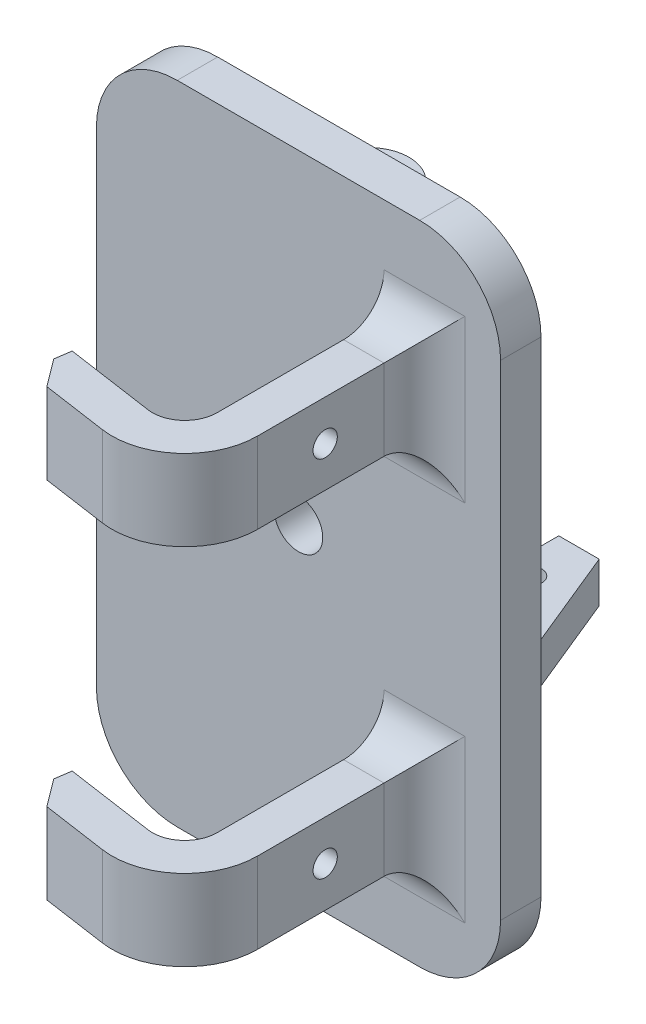
from build123d import *

# Parameters (mm, degrees)
ESQUISSE1_W             = 50
ESQUISSE1_H             = 80
BOSS_EXTRU_1_DEPTH      = 5
BOSS_EXTRU_2_START      = -42.4
ESQUISSE2_W             = 5
ESQUISSE2_H             = 12.2
ESQUISSE2_R             = 1.5
ESQUISSE2_W_2           = 5.01688185
BOSS_EXTRU_2_DEPTH      = 5
ESQUISSE3_R             = 3
ENL_V_MAT_EXTRU_1_DEPTH = 51.207967495
BOSS_EXTRU_3_START      = -10
ESQUISSE5_R             = 1.375
BOSS_EXTRU_3_DEPTH      = 5
ESQUISSE6_R             = 1.375
BOSS_EXTRU_4_DEPTH      = 10
BOSS_EXTRU_5_START      = -12.5
BOSS_EXTRU_5_DEPTH      = 10
CONG_1_R                = 5
CONG_2_R                = 5
CONG_3_R                = 5
CONG_1_OF_SYM_TRIE1_R   = 5
CONG_2_OF_SYM_TRIE1_R   = 5
CONG_3_OF_SYM_TRIE1_R   = 5
CHANFREIN1_SIZE         = 3
BOSS_EXTRU_6_DEPTH      = 5
ESQUISSE10_R            = 1.5
ENL_V_MAT_EXTRU_2_DEPTH = 64.767186518
CONG_4_R                = 10
CHANFREIN5_START        = -9.492908537
CHANFREIN5_OUTLINE_W    = 12
CHANFREIN5_OUTLINE_H    = 5
CHANFREIN5_DEPTH        = 4.242640687
CHANFREIN6_START        = 1.820799962
CHANFREIN6_OUTLINE_W    = 12
CHANFREIN6_OUTLINE_H    = 5
CHANFREIN6_DEPTH        = 4.242640687
CONG_5_START            = 25
CONG_5_DEPTH            = 5
CONG_6_START            = 25
CONG_6_DEPTH            = 5


with BuildPart() as part:
    # Esquisse1 → Boss.-Extru.1 (new body)
    with BuildSketch(Plane.XY):
        Rectangle(ESQUISSE1_W, ESQUISSE1_H)
    extrude(amount=BOSS_EXTRU_1_DEPTH)

    # Esquisse2 → Boss.-Extru.2 (add)
    # profile 1 of 2: a face of its own
    with BuildSketch(Plane(origin=(0, 40, 0), x_dir=(1, 0, 0), z_dir=(0, 1, 0)).offset(BOSS_EXTRU_2_START)):
        with Locations((17.5, 6.1)):
            Rectangle(ESQUISSE2_W, ESQUISSE2_H)
        with Locations(Location((17.5, 6.1, 0), (0, 0, 270))):
            Circle(ESQUISSE2_R, mode=Mode.SUBTRACT)
    # profile 2 of 2: a face of its own
    with BuildSketch(Plane(origin=(0, 40, 0), x_dir=(1, 0, 0), z_dir=(0, 1, 0)).offset(BOSS_EXTRU_2_START)):
        with Locations((-10.508440925, 6.1)):
            Rectangle(ESQUISSE2_W_2, ESQUISSE2_H)
        with Locations(Location((-10.5, 6.1, 0), (0, 0, 270))):
            Circle(ESQUISSE2_R, mode=Mode.SUBTRACT)
    extrude(amount=-BOSS_EXTRU_2_DEPTH)

    # Esquisse3 → Enlèv. mat.-Extru.1 (cut, through all)
    with BuildSketch(Plane.XY.offset(5)):
        Circle(ESQUISSE3_R)
    extrude(amount=-ENL_V_MAT_EXTRU_1_DEPTH, mode=Mode.SUBTRACT)

    # Esquisse5 → Boss.-Extru.3 (add)
    with BuildSketch(Plane(origin=(0, 40, 0), x_dir=(1, 0, 0), z_dir=(0, 1, 0)).offset(BOSS_EXTRU_3_START)):
        with BuildLine():
            Line((-7.425, 6.1), (-7.425, 0))
            Line((-7.425, 0), (2.575, 0))
            Line((2.575, 0), (2.575, 6.1))
            ThreePointArc((2.575, 6.1), (-2.425, 11.1), (-7.425, 6.1))
        make_face()
        with Locations(Location((-2.425, 6.1, 0), (0, 0, 270))):
            Circle(ESQUISSE5_R, mode=Mode.SUBTRACT)
    extrude(amount=-BOSS_EXTRU_3_DEPTH)

    # Esquisse6 → Boss.-Extru.4 (add)
    with BuildSketch(Plane(origin=(0, 30, 0), x_dir=(1, 0, 0), z_dir=(0, 1, 0))):
        with Locations(Location((-2.425, 6.1, 0), (0, 0, 270))):
            Circle(ESQUISSE6_R)
    extrude(amount=-BOSS_EXTRU_4_DEPTH)

    # Esquisse7 → Boss.-Extru.5 (add)
    with BuildSketch(Plane.XZ.offset(40).offset(BOSS_EXTRU_5_START)):
        with BuildLine():
            Line((10.577424804, 5), (10.577424804, 25.648245565))
            ThreePointArc((10.577424804, 25.648245565), (9.193748636, 28.673943766), (6, 29.606348721))
            Line((6, 29.606348721), (-5, 28.001622266))
            Line((-5, 28.001622266), (-5.721781005, 32.949251212))
            Line((-5.721781005, 32.949251212), (5.278218995, 34.553977666))
            ThreePointArc((5.278218995, 34.553977666), (12.464153425, 32.456066518), (15.577424804, 25.648245565))
            Line((15.577424804, 25.648245565), (15.577424804, 5))
            Line((15.577424804, 5), (10.577424804, 5))
        make_face()
    boss_extru_5 = extrude(amount=-BOSS_EXTRU_5_DEPTH)

    # Congé1
    cong_1_edges = [part.edges().sort_by_distance(p)[0] for p in [
        (15.577424804, -22.5, 5),
    ]]
    fillet(cong_1_edges, radius=CONG_1_R)

    # Congé2
    cong_2_edges = [part.edges().sort_by_distance(p)[0] for p in [
        (15.577424804, -17.5, 5),
    ]]
    fillet(cong_2_edges, radius=CONG_2_R)

    # Congé3
    cong_3_edges = [part.edges().sort_by_distance(p)[0] for p in [
        (15.577424804, -27.5, 5),
    ]]
    fillet(cong_3_edges, radius=CONG_3_R)

    # Symétrie1: Boss.-Extru.5 across plane
    add(boss_extru_5.mirror(Plane.ZX))

    # Congé1 of Symétrie1
    cong_1_of_sym_trie1_edges = [part.edges().sort_by_distance(p)[0] for p in [
        (15.577424804, 22.5, 5),
    ]]
    fillet(cong_1_of_sym_trie1_edges, radius=CONG_1_OF_SYM_TRIE1_R)

    # Congé2 of Symétrie1
    cong_2_of_sym_trie1_edges = [part.edges().sort_by_distance(p)[0] for p in [
        (15.577424804, 17.5, 5),
    ]]
    fillet(cong_2_of_sym_trie1_edges, radius=CONG_2_OF_SYM_TRIE1_R)

    # Congé3 of Symétrie1
    cong_3_of_sym_trie1_edges = [part.edges().sort_by_distance(p)[0] for p in [
        (15.577424804, 27.5, 5),
    ]]
    fillet(cong_3_of_sym_trie1_edges, radius=CONG_3_OF_SYM_TRIE1_R)

    # Chanfrein1
    chanfrein1_edges = [part.edges().sort_by_distance(p)[0] for p in [
        (-5.721781005, 22.5, 32.949251212),
        (-5.721781005, -22.5, 32.949251212),
    ]]
    chamfer(chanfrein1_edges, length=CHANFREIN1_SIZE)

    # Esquisse9 → Boss.-Extru.6 (add)
    with BuildSketch(Plane(origin=(0, -2.4, 0), x_dir=(1, 0, 0), z_dir=(0, 1, 0))):
        Polygon((-13.01688185, 12.2), (-25, 0), (-13.01688185, 0), align=None)
        Polygon((20, 12.2), (25, 0), (20, 0), align=None)
    extrude(amount=-BOSS_EXTRU_6_DEPTH)

    # Esquisse10 → Enlèv. mat.-Extru.2 (cut, through all)
    with BuildSketch(Plane.ZY.offset(-10.577424804)):
        with Locations((17.274122782, -22.5)):
            Circle(ESQUISSE10_R)
        with Locations((17.274122782, 22.5)):
            Circle(ESQUISSE10_R)
    extrude(amount=-ENL_V_MAT_EXTRU_2_DEPTH, mode=Mode.SUBTRACT)

    # Congé4
    cong_4_edges = [part.edges().sort_by_distance(p)[0] for p in [
        (25, -40, 2.5),
        (-25, -40, 2.5),
        (-25, 40, 2.5),
        (25, 40, 2.5),
    ]]
    fillet(cong_4_edges, radius=CONG_4_R)

    # Chanfrein5: read off the stored shape, not the designer's step
    # Chanfrein5 outline → Chanfrein5 (add)
    with BuildSketch(Plane(origin=(0, 0, 0), x_dir=(0.707106781186548, 0, -0.707106781186547), z_dir=(0.707106781186547, 0, 0.707106781186548)).offset(CHANFREIN5_START)):
        with Locations((-5, 27.5)):
            Rectangle(CHANFREIN5_OUTLINE_W, CHANFREIN5_OUTLINE_H)
    extrude(amount=CHANFREIN5_DEPTH)

    # Chanfrein6: read off the stored shape, not the designer's step
    # Chanfrein6 outline → Chanfrein6 (add)
    with BuildSketch(Plane(origin=(0, 0, 0), x_dir=(0.707106781186548, 0, 0.707106781186547), z_dir=(0.707106781186547, 0, -0.707106781186548)).offset(CHANFREIN6_START)):
        with Locations((2, -27.5)):
            Rectangle(CHANFREIN6_OUTLINE_W, CHANFREIN6_OUTLINE_H)
    extrude(amount=CHANFREIN6_DEPTH)

    # Congé5: read off the stored shape, not the designer's step
    # Congé5 outline → Congé5 (add)
    with BuildSketch(Plane(origin=(0, 0, 0), x_dir=(1, 0, 0), z_dir=(0, 1, 0)).offset(CONG_5_START)):
        with BuildLine():
            ThreePointArc((-6.755521581, 8.599316474), (-9.663638899, 4.245895741), (-13.11542298, 0.30957702))
            Line((-13.11542298, 0.30957702), (-7.425, 6))
            Line((-7.425, 6), (-7.425, 6.1))
            ThreePointArc((-7.425, 6.1), (-7.254731251, 7.393714052), (-6.755521581, 8.599316474))
        make_face()
    extrude(amount=CONG_5_DEPTH)

    # Congé6: read off the stored shape, not the designer's step
    # Congé6 outline → Congé6 (add)
    with BuildSketch(Plane(origin=(0, 0, 0), x_dir=(1, 0, 0), z_dir=(0, 1, 0)).offset(CONG_6_START)):
        with BuildLine():
            ThreePointArc((8.26542298, 0.30957702), (4.813638899, 4.245895741), (1.905521581, 8.599316474))
            ThreePointArc((1.905521581, 8.599316474), (2.40473125, 7.393714052), (2.575, 6.1))
            Line((2.575, 6.1), (2.575, 6))
            Line((2.575, 6), (8.26542298, 0.30957702))
        make_face()
    extrude(amount=CONG_6_DEPTH)


solid = part.part
